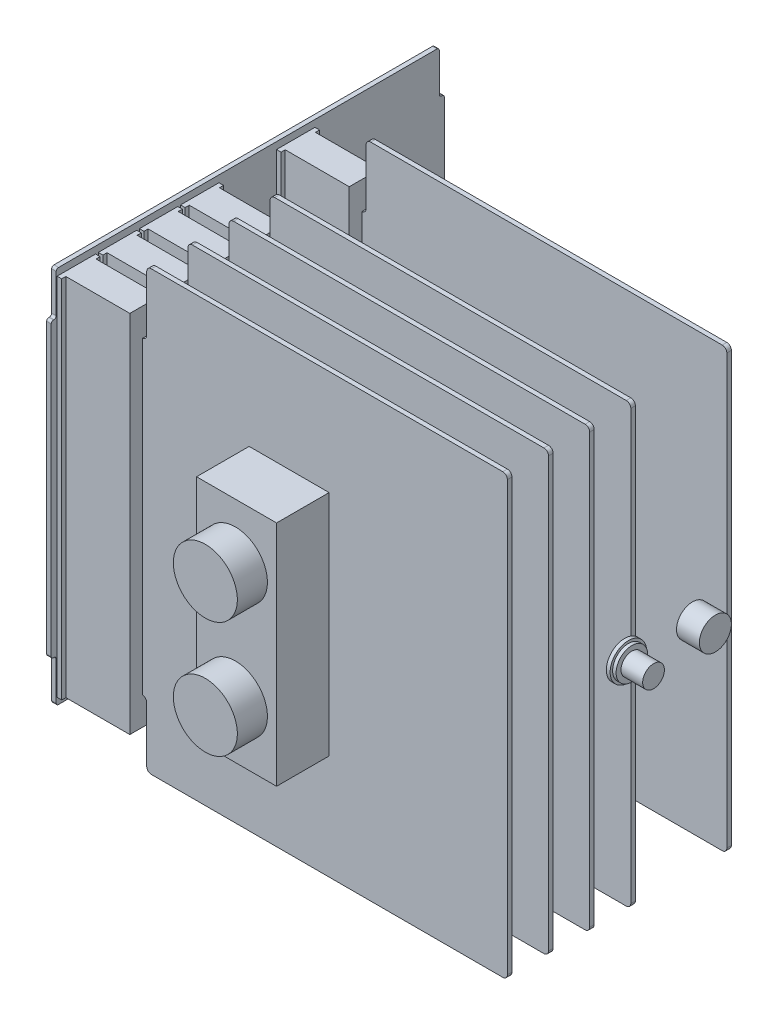
from build123d import *

# Parameters (mm, degrees)
SKETCH1_W            = 1.1
SKETCH1_H            = 64
SKETCH1_W_2          = 83.8
SKETCH1_H_2          = 82.8
BACK_DEPTH           = 1
FILLET1_R            = 0.5
BOLTHOLEHOLDER_DEPTH = 3
SKETCH3_R            = 1.23
BOLTHOLES_DEPTH      = 119.658543729
SKETCH4_W            = 8.4
SKETCH4_H            = 79.8
BOARDHOLDER1_DEPTH   = 1
SKETCH5_W            = 6.6
SKETCH5_H            = 79.8
BOARDHOLDER2_DEPTH   = 14
BOARDHOLDERS1_COUNT  = 4
BOARDHOLDERS1_PITCH  = 9
BOARDHOLDERS2_COUNT  = 2
BOARDHOLDERS2_PITCH  = 48
SKETCH6_W            = 0.9
SKETCH6_H            = 67.6
SKETCH6_W_2          = 78.9
SKETCH6_H_2          = 95.8
BOSS_EXTRUDE5_DEPTH  = 0.5
FILLET2_R            = 1
LPATTERN3_START      = 30.9
LPATTERN3_DEPTH      = 1
LPATTERN4_START      = 51.9
LPATTERN4_DEPTH      = 1
LPATTERN4_START_2    = 60.9
LPATTERN4_2_DEPTH    = 1
LPATTERN4_START_3    = 69.9
LPATTERN4_3_DEPTH    = 1
SKETCH7_W            = 17.5
SKETCH7_H            = 49.9
CAMERAS_DEPTH        = 11.5
SKETCH8_R            = 7
BOSS_EXTRUDE10_DEPTH = 6.58
SKETCH11_R           = 4
RBF_HOLDER_DEPTH     = 0.825
SKETCH12_R           = 3.4545
RBF_BOSS_DEPTH       = 0.762
SKETCH13_R           = 2.3815
RBF_PIN_DEPTH        = 4.738
SKETCH14_R           = 3.5
BOSS_EXTRUDE14_DEPTH = 5


with BuildPart() as part:
    # Sketch1 → Back (new body)
    with BuildSketch(Plane(origin=(0, 0, 0), x_dir=(0, 0, -1), z_dir=(1, 0, 0))):
        with Locations((-84.35, 41.4)):
            Rectangle(SKETCH1_W, SKETCH1_H)
        with Locations((-41.9, 41.4)):
            Rectangle(SKETCH1_W_2, SKETCH1_H_2)
        with Locations((0.55, 41.4)):
            Rectangle(SKETCH1_W, SKETCH1_H)
    extrude(amount=BACK_DEPTH)

    # Fillet1
    fillet1_edges = [part.edges().sort_by_distance(p)[0] for p in [
        (0.5, 73.4, 84.9),
        (0.5, 73.4, 83.8),
        (0.5, 82.8, 83.8),
        (0.5, 82.8, 0),
        (0.5, 0, 0),
        (0.5, 0, 83.8),
        (0.5, 9.4, 83.8),
        (0.5, 9.4, 84.9),
        (0.5, 73.4, 0),
        (0.5, 9.4, 0),
        (0.5, 9.4, -1.1),
        (0.5, 73.4, -1.1),
    ]]
    fillet(fillet1_edges, radius=FILLET1_R)

    # Sketch2 → Boltholeholder (add)
    with BuildSketch(Plane(origin=(1, 0, 0), x_dir=(0, 0, -1), z_dir=(1, 0, 0))):
        with BuildLine():
            Line((-44.9, 55.4), (-44.9, 27.4))
            ThreePointArc((-44.9, 27.4), (-41.9, 24.4), (-38.9, 27.4))
            Line((-38.9, 27.4), (-38.9, 55.4))
            ThreePointArc((-38.9, 55.4), (-41.9, 58.4), (-44.9, 55.4))
        make_face()
    extrude(amount=BOLTHOLEHOLDER_DEPTH)

    # Sketch3 → boltholes (cut, through all)
    with BuildSketch(Plane(origin=(4, 0, 0), x_dir=(0, 0, -1), z_dir=(1, 0, 0))):
        with Locations((-41.9, 27.4)):
            Circle(SKETCH3_R)
        with Locations((-41.9, 55.4)):
            Circle(SKETCH3_R)
    extrude(amount=-BOLTHOLES_DEPTH, mode=Mode.SUBTRACT)

    # Sketch4 → BoardHolder1 (add)
    with BuildSketch(Plane(origin=(1, 0, 0), x_dir=(0, 0, -1), z_dir=(1, 0, 0))):
        with Locations((-79.4, 41.4)):
            Rectangle(SKETCH4_W, SKETCH4_H)
    boardholder1 = extrude(amount=BOARDHOLDER1_DEPTH)

    # Sketch5 → BoardHolder2 (add)
    with BuildSketch(Plane(origin=(2, 0, 0), x_dir=(0, 0, -1), z_dir=(1, 0, 0))):
        with Locations((-79.4, 41.4)):
            Rectangle(SKETCH5_W, SKETCH5_H)
    boardholder2 = extrude(amount=BOARDHOLDER2_DEPTH)

    # BoardHolders1: BoardHolder1, BoardHolder2 ×4
    with Locations(*[(0, 0, -i * BOARDHOLDERS1_PITCH) for i in range(1, BOARDHOLDERS1_COUNT)]):
        add(boardholder1)
        add(boardholder2)

    # BoardHolders2: BoardHolder1, BoardHolder2 ×2
    with Locations(*[(0, 0, -i * BOARDHOLDERS2_PITCH) for i in range(1, BOARDHOLDERS2_COUNT)]):
        add(boardholder1)
        add(boardholder2)

    # Sketch6 → Boss-Extrude5 (add, symmetric)
    with BuildSketch(Plane.XY.offset(79.4)):
        with Locations((16.45, 41.4)):
            Rectangle(SKETCH6_W, SKETCH6_H)
        with Locations((56.35, 41.4)):
            Rectangle(SKETCH6_W_2, SKETCH6_H_2)
    extrude(amount=BOSS_EXTRUDE5_DEPTH, both=True)

    # Fillet2
    # the kernel refuses this fillet: 1 mm, written as the material it adds along each edge
    with BuildSketch(Plane(origin=(16.9, 75.2, 78.9), x_dir=(-1, 0, 0), z_dir=(0, 0, 1))) as fillet2_piece_1:
        with BuildLine():
            CenterArc((1, -0.994987437), FILLET2_R, 95.739170477, 84.260829523)
            Line((0, -0.994987437), (0, 0))
            Line((0, 0), (0.9, 0))
        make_face()
    extrude(amount=1)
    with BuildSketch(Plane(origin=(16.9, 7.6, 78.9), x_dir=(-1, 0, 0), z_dir=(0, 0, 1))) as fillet2_piece_2:
        with BuildLine():
            CenterArc((1, 0.994987437), FILLET2_R, 180, 84.260829523)
            Line((0, 0.994987437), (0, 0))
            Line((0, 0), (0.9, 0))
        make_face()
    extrude(amount=1)
    # the kernel refuses this fillet: 1 mm, written as the material it takes off along each edge
    with BuildSketch(Plane(origin=(16.9, 89.3, 82.4), x_dir=(0, -1, 0), z_dir=(0, 0, -1)), Plane(origin=(95.8, 89.3, 76.4), x_dir=(0, -1, 0), z_dir=(0, 0, 1)), Plane(origin=(95.8, -6.5, 76.4), x_dir=(-1, 0, 0), z_dir=(0, 0, 1)), Plane(origin=(16.9, -6.5, 82.4), x_dir=(1, 0, 0), z_dir=(0, 0, -1))) as fillet2_2_piece_1:
        with BuildLine():
            CenterArc((FILLET2_R, -FILLET2_R), FILLET2_R, 90, 90)
            Line((0, -FILLET2_R), (0, 0))
            Line((0, 0), (FILLET2_R, 0))
        make_face()
    extrude(amount=6, mode=Mode.SUBTRACT)

    # LPattern3: read off the stored shape, not the designer's step
    # LPattern3 outline → LPattern3 (add)
    with BuildSketch(Plane.XY.offset(LPATTERN3_START)):
        with BuildLine():
            Line((16.9, 88.3), (16.9, 76.194987437))
            ThreePointArc((16.9, 76.194987437), (16.641619849, 75.524167044), (16, 75.2))
            Line((16, 75.2), (16, 7.6))
            ThreePointArc((16, 7.6), (16.641619849, 7.275832956), (16.9, 6.605012563))
            Line((16.9, 6.605012563), (16.9, -5.5))
            ThreePointArc((16.9, -5.5), (17.192893219, -6.207106781), (17.9, -6.5))
            Line((17.9, -6.5), (94.8, -6.5))
            ThreePointArc((94.8, -6.5), (95.507106781, -6.207106781), (95.8, -5.5))
            Line((95.8, -5.5), (95.8, 88.3))
            ThreePointArc((95.8, 88.3), (95.507106781, 89.007106781), (94.8, 89.3))
            Line((94.8, 89.3), (17.9, 89.3))
            ThreePointArc((17.9, 89.3), (17.192893219, 89.007106781), (16.9, 88.3))
        make_face()
    extrude(amount=LPATTERN3_DEPTH)

    # LPattern4: read off the stored shape, not the designer's step
    # LPattern4 outline → LPattern4 (add)
    with BuildSketch(Plane.XY.offset(LPATTERN4_START)):
        with BuildLine():
            Line((16.9, 88.3), (16.9, 76.194987437))
            ThreePointArc((16.9, 76.194987437), (16.641619849, 75.524167044), (16, 75.2))
            Line((16, 75.2), (16, 7.6))
            ThreePointArc((16, 7.6), (16.641619849, 7.275832956), (16.9, 6.605012563))
            Line((16.9, 6.605012563), (16.9, -5.5))
            ThreePointArc((16.9, -5.5), (17.192893219, -6.207106781), (17.9, -6.5))
            Line((17.9, -6.5), (94.8, -6.5))
            ThreePointArc((94.8, -6.5), (95.507106781, -6.207106781), (95.8, -5.5))
            Line((95.8, -5.5), (95.8, 88.3))
            ThreePointArc((95.8, 88.3), (95.507106781, 89.007106781), (94.8, 89.3))
            Line((94.8, 89.3), (17.9, 89.3))
            ThreePointArc((17.9, 89.3), (17.192893219, 89.007106781), (16.9, 88.3))
        make_face()
    extrude(amount=LPATTERN4_DEPTH)

    # LPattern4 2 outline → LPattern4 2 (add)
    with BuildSketch(Plane.XY.offset(LPATTERN4_START_2)):
        with BuildLine():
            Line((16.9, 88.3), (16.9, 76.194987437))
            ThreePointArc((16.9, 76.194987437), (16.641619849, 75.524167044), (16, 75.2))
            Line((16, 75.2), (16, 7.6))
            ThreePointArc((16, 7.6), (16.641619849, 7.275832956), (16.9, 6.605012563))
            Line((16.9, 6.605012563), (16.9, -5.5))
            ThreePointArc((16.9, -5.5), (17.192893219, -6.207106781), (17.9, -6.5))
            Line((17.9, -6.5), (94.8, -6.5))
            ThreePointArc((94.8, -6.5), (95.507106781, -6.207106781), (95.8, -5.5))
            Line((95.8, -5.5), (95.8, 88.3))
            ThreePointArc((95.8, 88.3), (95.507106781, 89.007106781), (94.8, 89.3))
            Line((94.8, 89.3), (17.9, 89.3))
            ThreePointArc((17.9, 89.3), (17.192893219, 89.007106781), (16.9, 88.3))
        make_face()
    extrude(amount=LPATTERN4_2_DEPTH)

    # LPattern4 3 outline → LPattern4 3 (add)
    with BuildSketch(Plane.XY.offset(LPATTERN4_START_3)):
        with BuildLine():
            Line((16.9, 88.3), (16.9, 76.194987437))
            ThreePointArc((16.9, 76.194987437), (16.641619849, 75.524167044), (16, 75.2))
            Line((16, 75.2), (16, 7.6))
            ThreePointArc((16, 7.6), (16.641619849, 7.275832956), (16.9, 6.605012563))
            Line((16.9, 6.605012563), (16.9, -5.5))
            ThreePointArc((16.9, -5.5), (17.192893219, -6.207106781), (17.9, -6.5))
            Line((17.9, -6.5), (94.8, -6.5))
            ThreePointArc((94.8, -6.5), (95.507106781, -6.207106781), (95.8, -5.5))
            Line((95.8, -5.5), (95.8, 88.3))
            ThreePointArc((95.8, 88.3), (95.507106781, 89.007106781), (94.8, 89.3))
            Line((94.8, 89.3), (17.9, 89.3))
            ThreePointArc((17.9, 89.3), (17.192893219, 89.007106781), (16.9, 88.3))
        make_face()
    extrude(amount=LPATTERN4_3_DEPTH)

    # Sketch7 → Cameras (add)
    with BuildSketch(Plane.XY.offset(79.9)):
        with Locations((48.05, 41.4)):
            Rectangle(SKETCH7_W, SKETCH7_H)
    extrude(amount=CAMERAS_DEPTH)

    # Sketch8 → Boss-Extrude10 (add)
    with BuildSketch(Plane.XY.offset(91.4)):
        with Locations(Location((47.8, 28.7, 0), (0, 0, 180))):
            Circle(SKETCH8_R)
        with Locations(Location((47.8, 54.1, 0), (0, 0, 180))):
            Circle(SKETCH8_R)
    extrude(amount=BOSS_EXTRUDE10_DEPTH)

    # Sketch11 → RBF_holder (add)
    with BuildSketch(Plane(origin=(95.8, 0, 0), x_dir=(0, 0, -1), z_dir=(1, 0, 0))):
        with Locations(Location((-54.25, 41.4, 0), (0, 0, 70.275366441))):
            Circle(SKETCH11_R)
    extrude(amount=RBF_HOLDER_DEPTH)

    # Sketch12 → RBF_boss (add)
    with BuildSketch(Plane(origin=(96.625, 0, 0), x_dir=(0, 0, -1), z_dir=(1, 0, 0))):
        with Locations(Location((-54.25, 41.4, 0), (0, 0, 180))):
            Circle(SKETCH12_R)
    extrude(amount=RBF_BOSS_DEPTH)

    # Sketch13 → RBF_pin (add)
    with BuildSketch(Plane(origin=(97.387, 0, 0), x_dir=(0, 0, -1), z_dir=(1, 0, 0))):
        with Locations((-54.25, 41.4)):
            Circle(SKETCH13_R)
    extrude(amount=RBF_PIN_DEPTH)


with BuildPart() as body_2:
    # Sketch14 → Boss-Extrude14 (new body)
    with BuildSketch(Plane(origin=(95.8, 0, 0), x_dir=(0, 0, -1), z_dir=(1, 0, 0))):
        with Locations((-39.4, 41.4)):
            Circle(SKETCH14_R)
    extrude(amount=BOSS_EXTRUDE14_DEPTH)


solid = Compound([part.part, body_2.part])
